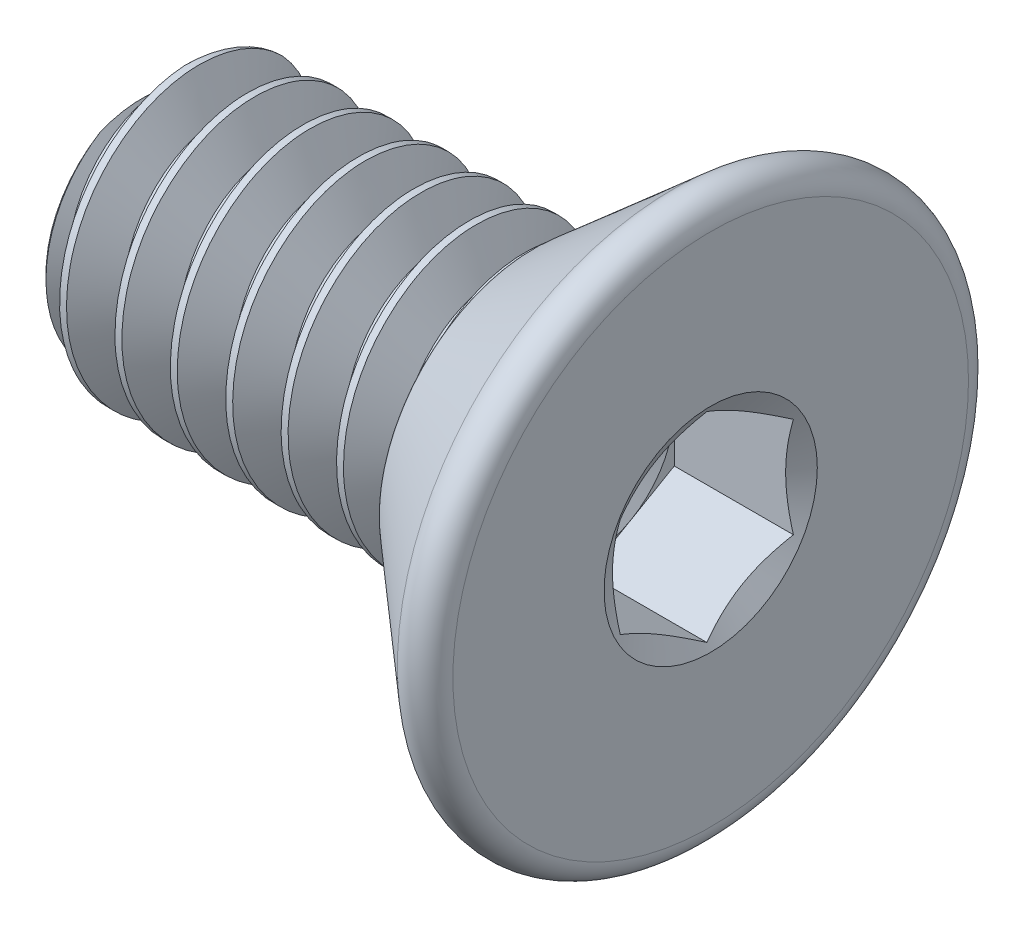
from build123d import *

# Parameters (mm, degrees)
CUT_EXTRUDE1_DEPTH = 2.8194
CUT_SWEEP1_PITCH   = 1.27
CUT_SWEEP1_TO      = 8.6106


with BuildPart() as part:
    # Sketch3 → Revolve1 (revolve)
    with BuildSketch(Plane.XY, mode=Mode.PRIVATE) as revolve1_sk:
        with BuildLine():
            Line((-5.715, 3.175), (-6.35, 2.54))
            Line((-6.35, 2.54), (-6.35, 0))
            Line((-6.35, 0), (6.35, 0))
            Line((6.35, 0), (6.35, 5.91088412))
            ThreePointArc((6.35, 5.91088412), (6.040948738, 6.391358121), (5.475574535, 6.309382763))
            Line((5.475574535, 6.309382763), (2.308169991, 3.556))
            ThreePointArc((2.308169991, 3.556), (2.27305313, 3.50897282), (2.2606, 3.451617182))
            Line((2.2606, 3.451617182), (2.2606, 3.313308591))
            ThreePointArc((2.2606, 3.313308591), (2.220090352, 3.215509648), (2.122291409, 3.175))
            Line((2.122291409, 3.175), (-5.715, 3.175))
        make_face()
    revolve(revolve1_sk.sketch.rotate(Axis((6.35, 0, 0), (-1, 0, 0)), 90), axis=Axis((6.35, 0, 0), (-1, 0, 0)))

    # Sketch4 → Cut-Extrude1 (cut)
    with BuildSketch(Plane(origin=(6.35, 0, 0), x_dir=(0, 0, -1), z_dir=(1, 0, 0))):
        Polygon((0, 2.291358881), (-1.984375, 1.14567944), (-1.984375, -1.14567944), (0, -2.291358881), (1.984375, -1.14567944), (1.984375, 1.14567944), align=None)
    extrude(amount=-CUT_EXTRUDE1_DEPTH, mode=Mode.SUBTRACT)

    # Cut-Extrude2 cone 1 section (through the dimple's axis) → Cut-Extrude2 (revolve, cut)
    with BuildSketch(Plane(origin=(6.35, 0, 0), x_dir=(0, 0, -1), z_dir=(0, 1, 0))):
        Polygon((0, 0), (2.444850821, 0), (0, 1.41153528), align=None)
    revolve(axis=Axis((6.35, 0, 0), (-1, 0, 0)), mode=Mode.SUBTRACT)

    # Cut-Extrude3 cone 1 section (through the dimple's axis) → Cut-Extrude3 (revolve, cut)
    with BuildSketch(Plane(origin=(3.5306, 0, 0), x_dir=(0, 0, -1), z_dir=(0, 1, 0))):
        Polygon((0, 0), (1.984375, 0), (0, 1.14567944), align=None)
    revolve(axis=Axis((3.5306, 0, 0), (-1, 0, 0)), mode=Mode.SUBTRACT)


with BuildPart() as body_2:
    # Split1: read off the stored shape, not the designer's step
    # Split1: the piece on the far side of the plane
    add(part.part)
    split(bisect_by=Plane.YZ.offset(2.2606), keep=Keep.BOTTOM)

    # Cut-Sweep1: arcs per turn and ends read off the stored shape
    # Cut-Sweep1: the profile of Sketch7 screwed along a right-hand helix through 10 turns, 8 arcs to a turn; built about Z, then put on its axis
    cut_sweep1_z = Axis((0, 0, 0), (0, 0, 1))
    cut_sweep1_corners = [(2.350110803, 0, -0.635), (3.243740766, 0, -1.1509375), (3.243740766, 0, 0.0396875), (2.350110803, 0, -0.47625)]
    with BuildLine(mode=Mode.PRIVATE) as cut_sweep1_profile:
        Line(cut_sweep1_corners[0], cut_sweep1_corners[1])
        Line(cut_sweep1_corners[1], cut_sweep1_corners[2])
        Line(cut_sweep1_corners[2], cut_sweep1_corners[3])
        Line(cut_sweep1_corners[3], cut_sweep1_corners[0])
    cut_sweep1_cap = Face(cut_sweep1_profile.wire())
    cut_sweep1_turn_angles = [0, 22.5, 45, 67.5, 90, 112.5, 135, 157.5, 180, 202.5, 225, 247.5, 270, 292.5, 315, 337.5, 360]
    cut_sweep1_turn_weights = [1, 0.9238795325112867, 1, 0.9238795325112867, 1, 0.9238795325112867, 1, 0.9238795325112867, 1, 0.9238795325112867, 1, 0.9238795325112867, 1, 0.9238795325112867, 1, 0.9238795325112867, 1]
    cut_sweep1_turn_rails = [Edge.make_bspline([Vector(p[0], p[1], 0).rotate(cut_sweep1_z, cut_sweep1_turn_angles[k]) / cut_sweep1_turn_weights[k] + Vector(0, 0, p[2] + CUT_SWEEP1_PITCH * cut_sweep1_turn_angles[k] / 360) for k in range(17)], [0, 0, 0, 1, 1, 2, 2, 3, 3, 4, 4, 5, 5, 6, 6, 7, 7, 8, 8, 8], 2, cut_sweep1_turn_weights) for p in cut_sweep1_corners]
    cut_sweep1_turn_sides = [Face.make_surface_from_curves(cut_sweep1_turn_rails[p[0]], cut_sweep1_turn_rails[p[1]]) for p in [(0, 1), (1, 2), (2, 3), (3, 0)]]
    cut_sweep1 = Plane(origin=(-6.35, 0, 0), x_dir=(0, -1, 0), z_dir=(1, 0, 0)) * split(Solid(Shell([*[p.moved(Location((0, 0, CUT_SWEEP1_PITCH * i))) for i in range(10) for p in cut_sweep1_turn_sides], cut_sweep1_cap, cut_sweep1_cap.rotate(cut_sweep1_z, 3600).moved(Location((0, 0, CUT_SWEEP1_PITCH * 3600 / 360)))])), bisect_by=Plane.XY.offset(CUT_SWEEP1_TO), keep=Keep.BOTTOM, mode=Mode.PRIVATE)
    add(cut_sweep1, mode=Mode.SUBTRACT)


with BuildPart() as part_1:
    add(part.part)

    # Split1
    split(bisect_by=Plane.YZ.offset(2.2606), keep=Keep.TOP)


with BuildPart() as body_2_1:
    add(body_2.part)

    # Combine1: union part
    add(part_1.part)


solid = body_2_1.part
